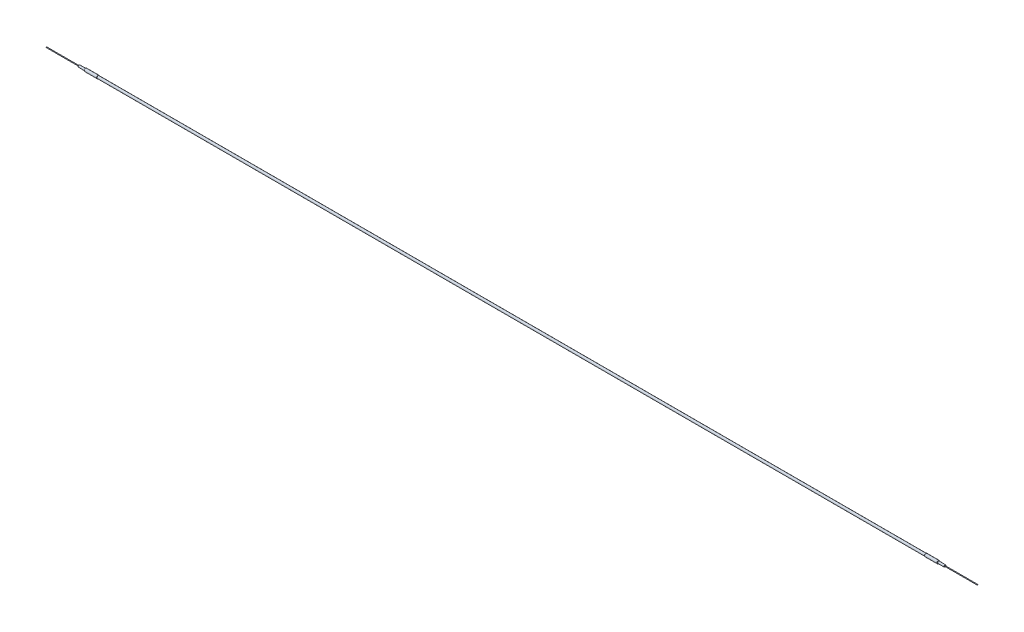
from build123d import *

# Parameters (mm, degrees)
SKETCH3_R           = 4.7625
BOSS_EXTRUDE1_DEPTH = 3230.88
SKETCH4_R           = 5.4991
BOSS_EXTRUDE2_DEPTH = 50.8
BOSS_EXTRUDE3_START = 50.8
SKETCH5_R           = 5.4991
BOSS_EXTRUDE3_DEPTH = 50.8
SKETCH6_R           = 3.81
BOSS_EXTRUDE4_DEPTH = 25.4
BOSS_EXTRUDE5_START = 25.4
SKETCH7_R           = 3.81
BOSS_EXTRUDE5_DEPTH = 25.4
CHAMFER1_SIZE       = 1.27
SKETCH8_R           = 1.27
BOSS_EXTRUDE6_DEPTH = 127
BOSS_EXTRUDE7_START = 127
SKETCH9_R           = 1.27
BOSS_EXTRUDE7_DEPTH = 127


with BuildPart() as part:
    # Sketch3 → Boss-Extrude1 (new body)
    with BuildSketch(Plane(origin=(0, 0, 0), x_dir=(0, 0, -1), z_dir=(1, 0, 0))):
        with Locations(Location((0, 0, 0), (0, 0, 180))):
            Circle(SKETCH3_R)
    extrude(amount=BOSS_EXTRUDE1_DEPTH)

    # Sketch4 → Boss-Extrude2 (add)
    with BuildSketch(Plane(origin=(3230.88, 0, 0), x_dir=(0, 0, -1), z_dir=(1, 0, 0))):
        Circle(SKETCH4_R)
    extrude(amount=BOSS_EXTRUDE2_DEPTH)

    # Sketch5 → Boss-Extrude3 (add)
    with BuildSketch(Plane.ZY.offset(BOSS_EXTRUDE3_START)):
        with Locations(Location((0, 0, 0), (0, 0, 180))):
            Circle(SKETCH5_R)
    extrude(amount=-BOSS_EXTRUDE3_DEPTH)

    # Sketch6 → Boss-Extrude4 (add)
    with BuildSketch(Plane.ZY.offset(50.8)):
        Circle(SKETCH6_R)
    extrude(amount=BOSS_EXTRUDE4_DEPTH)

    # Sketch7 → Boss-Extrude5 (add)
    with BuildSketch(Plane(origin=(3281.68, 0, 0), x_dir=(0, 0, -1), z_dir=(1, 0, 0)).offset(BOSS_EXTRUDE5_START)):
        with Locations(Location((0, 0, 0), (0, 0, 180))):
            Circle(SKETCH7_R)
    extrude(amount=-BOSS_EXTRUDE5_DEPTH)

    # Chamfer1
    # the kernel refuses this chamfer: 1.27 mm, written as the material it takes off along each edge
    with BuildSketch(Plane(origin=(-76.2, 0, 0), x_dir=(0, 0, 1), z_dir=(0, -1, 0))) as chamfer1_piece_1:
        Polygon((3.81, -CHAMFER1_SIZE), (3.81 - CHAMFER1_SIZE, 0), (3.81, 0), align=None)
    revolve(axis=Axis((-76.2, 0, 0), (-1, 0, 0)), mode=Mode.SUBTRACT)
    with BuildSketch(Plane(origin=(0, 0, 0), x_dir=(0, 0, -1), z_dir=(0, 1, 0))) as chamfer1_piece_2_section:
        Polygon((5.4991, CHAMFER1_SIZE), (5.4991 - CHAMFER1_SIZE, 0), (5.4991, 0), align=None)
    chamfer1_piece_2 = revolve(axis=Axis((0, 0, 0), (-1, 0, 0)), mode=Mode.PRIVATE)
    chamfer1_piece_2 = chamfer1_piece_2 - Plane(origin=(-0.899385483, 0, 0), x_dir=(0, 0, 1), z_dir=(-1, 0, 0)) * Cylinder(4.7625, 22, mode=Mode.PRIVATE)
    add(chamfer1_piece_2, mode=Mode.SUBTRACT)
    with BuildSketch(Plane(origin=(-50.8, 0, 0), x_dir=(0, 0, -1), z_dir=(0, 1, 0))) as chamfer1_piece_3:
        Polygon((5.4991, -CHAMFER1_SIZE), (5.4991 - CHAMFER1_SIZE, 0), (5.4991, 0), align=None)
    revolve(axis=Axis((-50.8, 0, 0), (-1, 0, 0)), mode=Mode.SUBTRACT)
    with BuildSketch(Plane(origin=(3307.08, 0, 0), x_dir=(0, 0, 1), z_dir=(0, 1, 0))) as chamfer1_piece_4:
        Polygon((3.81, -CHAMFER1_SIZE), (3.81 - CHAMFER1_SIZE, 0), (3.81, 0), align=None)
    revolve(axis=Axis((3307.08, 0, 0), (1, 0, 0)), mode=Mode.SUBTRACT)
    with BuildSketch(Plane(origin=(3281.68, 0, 0), x_dir=(0, 0, -1), z_dir=(0, -1, 0))) as chamfer1_piece_5:
        Polygon((5.4991, -CHAMFER1_SIZE), (5.4991 - CHAMFER1_SIZE, 0), (5.4991, 0), align=None)
    revolve(axis=Axis((3281.68, 0, 0), (1, 0, 0)), mode=Mode.SUBTRACT)
    with BuildSketch(Plane(origin=(3230.88, 0, 0), x_dir=(0, 0, -1), z_dir=(0, -1, 0))) as chamfer1_piece_6_section:
        Polygon((5.4991 - CHAMFER1_SIZE, 0), (5.4991, CHAMFER1_SIZE), (5.4991, 0), align=None)
    chamfer1_piece_6 = revolve(axis=Axis((3230.88, 0, 0), (1, 0, 0)), mode=Mode.PRIVATE)
    chamfer1_piece_6 = chamfer1_piece_6 - Plane(origin=(3231.779385483, 0, 0), x_dir=(0, 0, 1), z_dir=(-1, 0, 0)) * Cylinder(4.7625, 22, mode=Mode.PRIVATE)
    add(chamfer1_piece_6, mode=Mode.SUBTRACT)

    # Sketch8 → Boss-Extrude6 (add)
    with BuildSketch(Plane.ZY.offset(76.2)):
        Circle(SKETCH8_R)
    extrude(amount=BOSS_EXTRUDE6_DEPTH)

    # Sketch9 → Boss-Extrude7 (add)
    with BuildSketch(Plane(origin=(3307.08, 0, 0), x_dir=(0, 0, -1), z_dir=(1, 0, 0)).offset(BOSS_EXTRUDE7_START)):
        with Locations(Location((0, 0, 0), (0, 0, 180))):
            Circle(SKETCH9_R)
    extrude(amount=-BOSS_EXTRUDE7_DEPTH)


solid = part.part
